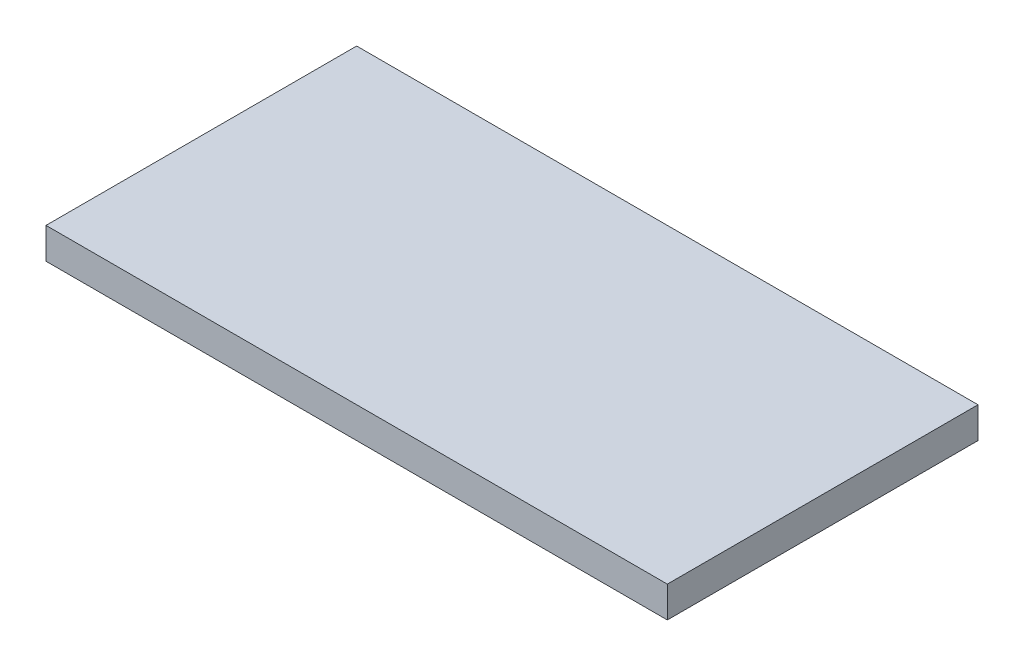
from build123d import *

# Parameters (mm, degrees)
SKETCH1_W           = 50.8
SKETCH1_H           = 25.4
BOSS_EXTRUDE1_DEPTH = 2.54


with BuildPart() as part:
    # Sketch1 → Boss-Extrude1 (new body)
    with BuildSketch(Plane(origin=(0, 0, 0), x_dir=(1, 0, 0), z_dir=(0, 1, 0))):
        Rectangle(SKETCH1_W, SKETCH1_H)
    extrude(amount=BOSS_EXTRUDE1_DEPTH)


solid = part.part
